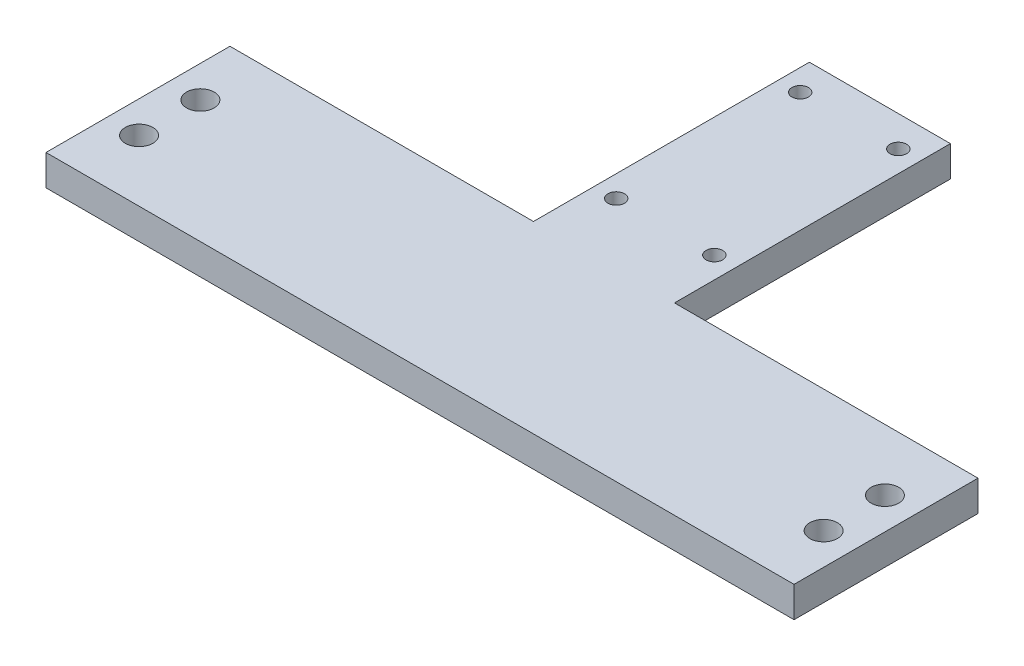
from build123d import *

# Parameters (mm, degrees)
SKETCH1_W           = 122
SKETCH1_H           = 30
BOSS_EXTRUDE1_DEPTH = 5
SKETCH2_W           = 23
SKETCH2_H           = 45
BOSS_EXTRUDE2_DEPTH = 5
SKETCH4_R           = 2.25
CUT_EXTRUDE2_DEPTH  = 86.708809349
SKETCH6_R           = 1.35
CUT_EXTRUDE3_DEPTH  = 86.708809349


with BuildPart() as part:
    # Sketch1 → Boss-Extrude1 (new body)
    with BuildSketch(Plane(origin=(0, 0, 0), x_dir=(1, 0, 0), z_dir=(0, 1, 0))):
        Rectangle(SKETCH1_W, SKETCH1_H)
    extrude(amount=BOSS_EXTRUDE1_DEPTH)

    # Sketch2 → Boss-Extrude2 (add)
    with BuildSketch(Plane(origin=(0, 0, 0), x_dir=(1, 0, 0), z_dir=(0, 1, 0))):
        with Locations((0, 37.5)):
            Rectangle(SKETCH2_W, SKETCH2_H)
    extrude(amount=BOSS_EXTRUDE2_DEPTH)

    # Sketch4 → Cut-Extrude2 (cut, through all)
    with BuildSketch(Plane(origin=(0, 5, 0), x_dir=(1, 0, 0), z_dir=(0, 1, 0))):
        with Locations((-55.822044415, 5)):
            Circle(SKETCH4_R)
        with Locations((-55.822044415, -5)):
            Circle(SKETCH4_R)
        with Locations((55.822044415, -5)):
            Circle(SKETCH4_R)
        with Locations((55.822044415, 5)):
            Circle(SKETCH4_R)
    extrude(amount=-CUT_EXTRUDE2_DEPTH, mode=Mode.SUBTRACT)

    # Sketch6 → Cut-Extrude3 (cut, through all)
    with BuildSketch(Plane(origin=(0, 5, 0), x_dir=(1, 0, 0), z_dir=(0, 1, 0))):
        with Locations((-8, 55)):
            Circle(SKETCH6_R)
        with Locations((-8, 25)):
            Circle(SKETCH6_R)
        with Locations((8, 25)):
            Circle(SKETCH6_R)
        with Locations((8, 55)):
            Circle(SKETCH6_R)
    extrude(amount=-CUT_EXTRUDE3_DEPTH, mode=Mode.SUBTRACT)


solid = part.part
